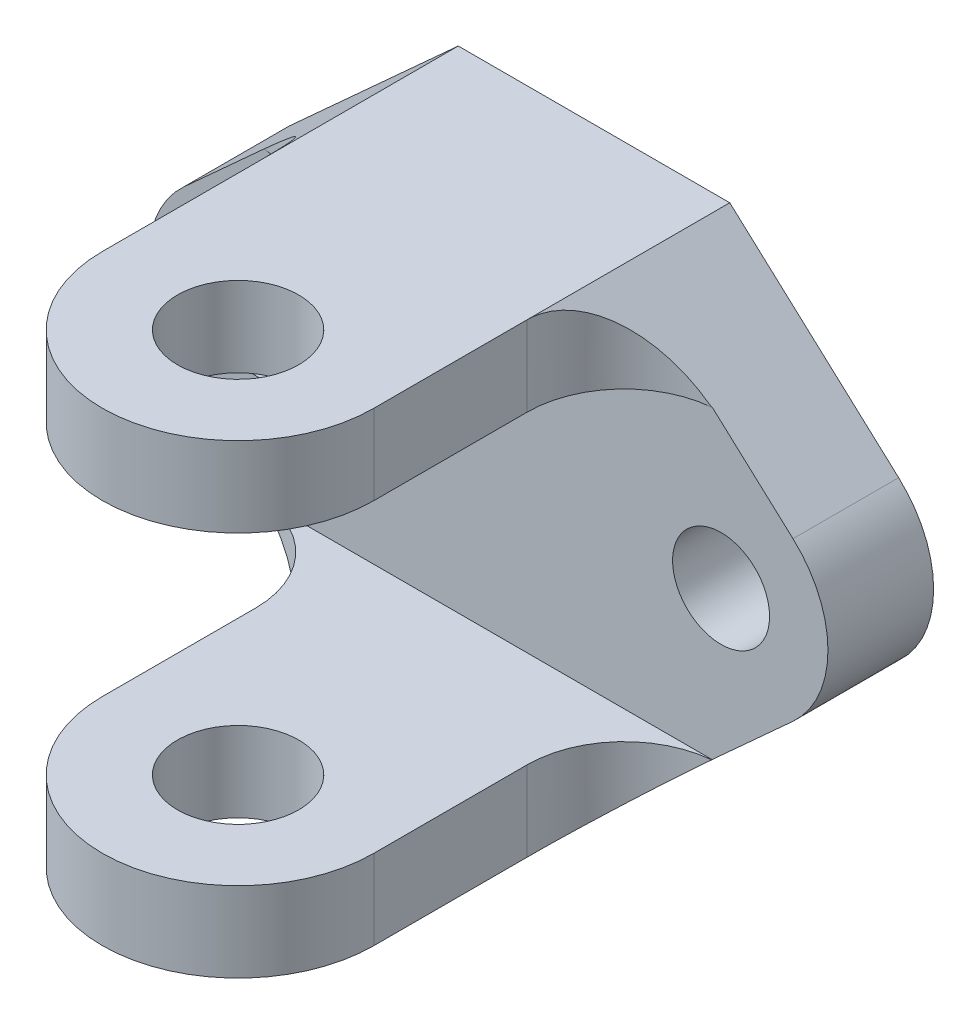
from build123d import *

# Parameters (mm, degrees)
SKETCH1_W                      = 46.48
SKETCH1_H                      = 30.48
SKETCH1_R                      = 3.175
BOSS_EXTRUDE1_DEPTH            = 9.46
SKETCH2_W                      = 46.48
SKETCH2_H                      = 5.24
BOSS_EXTRUDE2_DEPTH            = 53
CUT_EXTRUDE1_REACH             = 70.364
SKETCH4_R                      = 3.96875
CUT_EXTRUDE1_DIRECTION_2_REACH = 70.364
CUT_EXTRUDE3_REACH             = 70.364
CUT_EXTRUDE3_DIRECTION_2_REACH = 70.364
CUT_EXTRUDE4_DEPTH             = 9.46
BOSS_EXTRUDE3_DEPTH            = 9.46
FILLET3_R                      = 6.35
CUT_EXTRUDE5_DEPTH             = 2.54


with BuildPart() as part:
    # Sketch1 → Boss-Extrude1 (new body)
    with BuildSketch(Plane.XY):
        Rectangle(SKETCH1_W, SKETCH1_H)
        with Locations((15.24, 0)):
            Circle(SKETCH1_R, mode=Mode.SUBTRACT)
        with Locations((-15.24, 0)):
            Circle(SKETCH1_R, mode=Mode.SUBTRACT)
    extrude(amount=BOSS_EXTRUDE1_DEPTH)

    # Sketch2 → Boss-Extrude2 (add)
    with BuildSketch(Plane.XY.offset(9.46)):
        with Locations((0, 12.62)):
            Rectangle(SKETCH2_W, SKETCH2_H)
        with Locations((0, -12.62)):
            Rectangle(SKETCH2_W, SKETCH2_H)
    extrude(amount=BOSS_EXTRUDE2_DEPTH)

    # Cut-Extrude1: up to this face of the body (flat: up to its plane)
    cut_extrude1_end = Plane(part.part.faces().sort_by_distance((0, -15.24, 31.23))[0])
    # Sketch4 → Cut-Extrude1 (cut, up to the picked face)
    with BuildSketch(Plane(origin=(0, 0, 0), x_dir=(1, 0, 0), z_dir=(0, 1, 0)), mode=Mode.PRIVATE) as cut_extrude1_sk1:
        with Locations(Location((0, -25.8481308, 0), (0, 0, 270))):
            Circle(SKETCH4_R)
    cut_extrude1_tool1 = split(extrude(cut_extrude1_sk1.sketch, amount=-CUT_EXTRUDE1_REACH, mode=Mode.PRIVATE), bisect_by=cut_extrude1_end, keep=Keep.BOTH, mode=Mode.PRIVATE)
    add(cut_extrude1_tool1.solids().sort_by(Axis((0, 0, 25.848131), (0, -1, 0)))[0], mode=Mode.SUBTRACT)

    # Cut-Extrude1 direction 2: up to this face of the body (flat: up to its plane)
    cut_extrude1_direction_2_end = Plane(part.part.faces().sort_by_distance((0, 15.24, 31.23))[0])
    # Sketch4 → Cut-Extrude1 direction 2 (cut, up to the picked face)
    with BuildSketch(Plane(origin=(0, 0, 0), x_dir=(1, 0, 0), z_dir=(0, 1, 0)), mode=Mode.PRIVATE) as cut_extrude1_direction_2_sk1:
        with Locations(Location((0, -25.8481308, 0), (0, 0, 270))):
            Circle(SKETCH4_R)
    cut_extrude1_direction_2_tool1 = split(extrude(cut_extrude1_direction_2_sk1.sketch, amount=CUT_EXTRUDE1_DIRECTION_2_REACH, mode=Mode.PRIVATE), bisect_by=cut_extrude1_direction_2_end, keep=Keep.BOTH, mode=Mode.PRIVATE)
    add(cut_extrude1_direction_2_tool1.solids().sort_by(Axis((0, 0, 25.848131), (0, 1, 0)))[0], mode=Mode.SUBTRACT)

    # Cut-Extrude3: up to this face of the body (flat: up to its plane)
    cut_extrude3_end = Plane(part.part.faces().sort_by_distance((0, -15.24, 31.323322986))[0])
    # Sketch6 → Cut-Extrude3 (cut, up to the picked face)
    with BuildSketch(Plane(origin=(0, 0, 0), x_dir=(1, 0, 0), z_dir=(0, 1, 0)), mode=Mode.PRIVATE) as cut_extrude3_sk1:
        with BuildLine():
            Line((-8.89, -25.8481308), (-8.89, -17.46))
            Line((-8.89, -17.46), (-8.89, -9.46))
            Line((-8.89, -9.46), (-16.89, -9.46))
            Line((-16.89, -9.46), (-23.24, -9.46))
            Line((-23.24, -9.46), (-23.24, -62.46))
            Line((-23.24, -62.46), (23.24, -62.46))
            Line((23.24, -62.46), (23.24, -9.46))
            Line((23.24, -9.46), (16.89, -9.46))
            Line((16.89, -9.46), (8.89, -9.46))
            Line((8.89, -9.46), (8.89, -17.46))
            Line((8.89, -17.46), (8.89, -25.8481308))
            ThreePointArc((8.89, -25.8481308), (0, -34.7381308), (-8.89, -25.8481308))
        make_face()
    cut_extrude3_tool1 = split(extrude(cut_extrude3_sk1.sketch, amount=-CUT_EXTRUDE3_REACH, mode=Mode.PRIVATE), bisect_by=cut_extrude3_end, keep=Keep.BOTH, mode=Mode.PRIVATE)
    add(cut_extrude3_tool1.solids().sort_by(Axis((0, 0, 38.948856), (0, -1, 0)))[0], mode=Mode.SUBTRACT)

    # Cut-Extrude3 direction 2: up to this face of the body (flat: up to its plane)
    cut_extrude3_direction_2_end = Plane(part.part.faces().sort_by_distance((0, 15.24, 31.323322986))[0])
    # Sketch6 → Cut-Extrude3 direction 2 (cut, up to the picked face)
    with BuildSketch(Plane(origin=(0, 0, 0), x_dir=(1, 0, 0), z_dir=(0, 1, 0)), mode=Mode.PRIVATE) as cut_extrude3_direction_2_sk1:
        with BuildLine():
            Line((-8.89, -25.8481308), (-8.89, -17.46))
            Line((-8.89, -17.46), (-8.89, -9.46))
            Line((-8.89, -9.46), (-16.89, -9.46))
            Line((-16.89, -9.46), (-23.24, -9.46))
            Line((-23.24, -9.46), (-23.24, -62.46))
            Line((-23.24, -62.46), (23.24, -62.46))
            Line((23.24, -62.46), (23.24, -9.46))
            Line((23.24, -9.46), (16.89, -9.46))
            Line((16.89, -9.46), (8.89, -9.46))
            Line((8.89, -9.46), (8.89, -17.46))
            Line((8.89, -17.46), (8.89, -25.8481308))
            ThreePointArc((8.89, -25.8481308), (0, -34.7381308), (-8.89, -25.8481308))
        make_face()
    cut_extrude3_direction_2_tool1 = split(extrude(cut_extrude3_direction_2_sk1.sketch, amount=CUT_EXTRUDE3_DIRECTION_2_REACH, mode=Mode.PRIVATE), bisect_by=cut_extrude3_direction_2_end, keep=Keep.BOTH, mode=Mode.PRIVATE)
    add(cut_extrude3_direction_2_tool1.solids().sort_by(Axis((0, 0, 38.948856), (0, 1, 0)))[0], mode=Mode.SUBTRACT)

    # Sketch7 → Cut-Extrude4 (cut)
    with BuildSketch(Plane.XY):
        with BuildLine():
            ThreePointArc((-15.24, -7), (-22.24, 0), (-15.24, 7))
            Line((-15.24, 7), (-8.89, 7))
            Line((-8.89, 7), (-8.89, 15.24))
            Line((-8.89, 15.24), (-23.24, 15.24))
            Line((-23.24, 15.24), (-23.24, -15.24))
            Line((-23.24, -15.24), (-8.89, -15.24))
            Line((-8.89, -15.24), (-8.89, -7))
            Line((-8.89, -7), (-15.24, -7))
        make_face()
        with BuildLine():
            Line((8.89, 15.24), (8.89, 7))
            Line((8.89, 7), (15.24, 7))
            ThreePointArc((15.24, 7), (22.24, 0), (15.24, -7))
            Line((15.24, -7), (8.89, -7))
            Line((8.89, -7), (8.89, -15.24))
            Line((8.89, -15.24), (23.24, -15.24))
            Line((23.24, -15.24), (23.24, 15.24))
            Line((23.24, 15.24), (8.89, 15.24))
        make_face()
    extrude(amount=CUT_EXTRUDE4_DEPTH, mode=Mode.SUBTRACT)

    # Sketch8 → Boss-Extrude3 (add)
    with BuildSketch(Plane.XY):
        with BuildLine():
            Line((8.89, -15.24), (19.950515714, -5.177937978))
            ThreePointArc((19.950515714, -5.177937978), (17.765315243, -6.528612634), (15.24, -7))
            Line((15.24, -7), (8.89, -7))
            Line((8.89, -7), (8.89, -15.24))
        make_face()
        with BuildLine():
            ThreePointArc((-19.950515714, -5.177937978), (-17.765315243, -6.528612634), (-15.24, -7))
            Line((-15.24, -7), (-8.89, -7))
            Line((-8.89, -7), (-8.89, -15.24))
            Line((-8.89, -15.24), (-19.950515714, -5.177937978))
        make_face()
        with BuildLine():
            Line((8.89, 15.24), (19.950515714, 5.177937978))
            ThreePointArc((19.950515714, 5.177937978), (17.765315243, 6.528612634), (15.24, 7))
            Line((15.24, 7), (8.89, 7))
            Line((8.89, 7), (8.89, 15.24))
        make_face()
        with BuildLine():
            Line((-8.89, 15.24), (-19.950515714, 5.177937978))
            ThreePointArc((-19.950515714, 5.177937978), (-17.765315243, 6.528612634), (-15.24, 7))
            Line((-15.24, 7), (-8.89, 7))
            Line((-8.89, 7), (-8.89, 15.24))
        make_face()
    extrude(amount=BOSS_EXTRUDE3_DEPTH)

    # Fillet3
    # the kernel refuses this fillet: 6.35 mm, written as the material it adds along each edge
    with BuildSketch(Plane(origin=(8.89, -10, 9.46), x_dir=(0, 0, 1), z_dir=(0, -1, 0))) as fillet3_piece_1_section:
        with BuildLine():
            CenterArc((FILLET3_R, -FILLET3_R), FILLET3_R, 90, 90)
            Line((0, -FILLET3_R), (0, 0))
            Line((0, 0), (FILLET3_R, 0))
        make_face()
    fillet3_piece_1 = extrude(amount=5.24, mode=Mode.PRIVATE)
    fillet3_piece_1 = split(fillet3_piece_1, bisect_by=Plane(origin=(10.975439596, -13.342816984, 11.151175663), z_dir=(-0.6729308163346117, 0.7397054254412585, 0)), keep=Keep.TOP, mode=Mode.PRIVATE)
    add(fillet3_piece_1)
    with BuildSketch(Plane(origin=(-8.89, -10, 9.46), x_dir=(0, 0, 1), z_dir=(0, -1, 0))) as fillet3_piece_2_section:
        with BuildLine():
            CenterArc((FILLET3_R, FILLET3_R), FILLET3_R, 180, 90)
            Line((0, FILLET3_R), (0, 0))
            Line((0, 0), (FILLET3_R, 0))
        make_face()
    fillet3_piece_2 = extrude(amount=5.24, mode=Mode.PRIVATE)
    fillet3_piece_2 = split(fillet3_piece_2, bisect_by=Plane(origin=(-10.975439596, -13.342816984, 11.151175663), z_dir=(0.6729308163346114, 0.7397054254412588, 0)), keep=Keep.TOP, mode=Mode.PRIVATE)
    add(fillet3_piece_2)
    with BuildSketch(Plane(origin=(8.89, 10, 9.46), x_dir=(1, 0, 0), z_dir=(0, 1, 0))) as fillet3_piece_3_section:
        with BuildLine():
            CenterArc((FILLET3_R, -FILLET3_R), FILLET3_R, 90, 90)
            Line((0, -FILLET3_R), (0, 0))
            Line((0, 0), (FILLET3_R, 0))
        make_face()
    fillet3_piece_3 = extrude(amount=5.24, mode=Mode.PRIVATE)
    fillet3_piece_3 = split(fillet3_piece_3, bisect_by=Plane(origin=(10.975439596, 13.342816985, 11.151175663), z_dir=(-0.6729308163346115, -0.7397054254412587, 0)), keep=Keep.TOP, mode=Mode.PRIVATE)
    add(fillet3_piece_3)
    with BuildSketch(Plane(origin=(-8.89, 10, 9.46), x_dir=(-1, 0, 0), z_dir=(0, 1, 0))) as fillet3_piece_4_section:
        with BuildLine():
            CenterArc((FILLET3_R, FILLET3_R), FILLET3_R, 180, 90)
            Line((0, FILLET3_R), (0, 0))
            Line((0, 0), (FILLET3_R, 0))
        make_face()
    fillet3_piece_4 = extrude(amount=5.24, mode=Mode.PRIVATE)
    fillet3_piece_4 = split(fillet3_piece_4, bisect_by=Plane(origin=(-10.975439596, 13.342816985, 11.151175663), z_dir=(0.6729308163346117, -0.7397054254412585, 0)), keep=Keep.TOP, mode=Mode.PRIVATE)
    add(fillet3_piece_4)

    # Sketch10 → Cut-Extrude5 (cut)
    with BuildSketch(Plane.XY):
        with BuildLine():
            Line((-8.89, 15.24), (-19.950515714, 5.177937978))
            ThreePointArc((-19.950515714, 5.177937978), (-22.24, 0), (-19.950515714, -5.177937978))
            Line((-19.950515714, -5.177937978), (-8.89, -15.24))
            Line((-8.89, -15.24), (8.89, -15.24))
            Line((8.89, -15.24), (19.950515714, -5.177937978))
            ThreePointArc((19.950515714, -5.177937978), (22.24, 0), (19.950515714, 5.177937978))
            Line((19.950515714, 5.177937978), (8.89, 15.24))
            Line((8.89, 15.24), (-8.89, 15.24))
        make_face()
    extrude(amount=CUT_EXTRUDE5_DEPTH, mode=Mode.SUBTRACT)


solid = part.part
